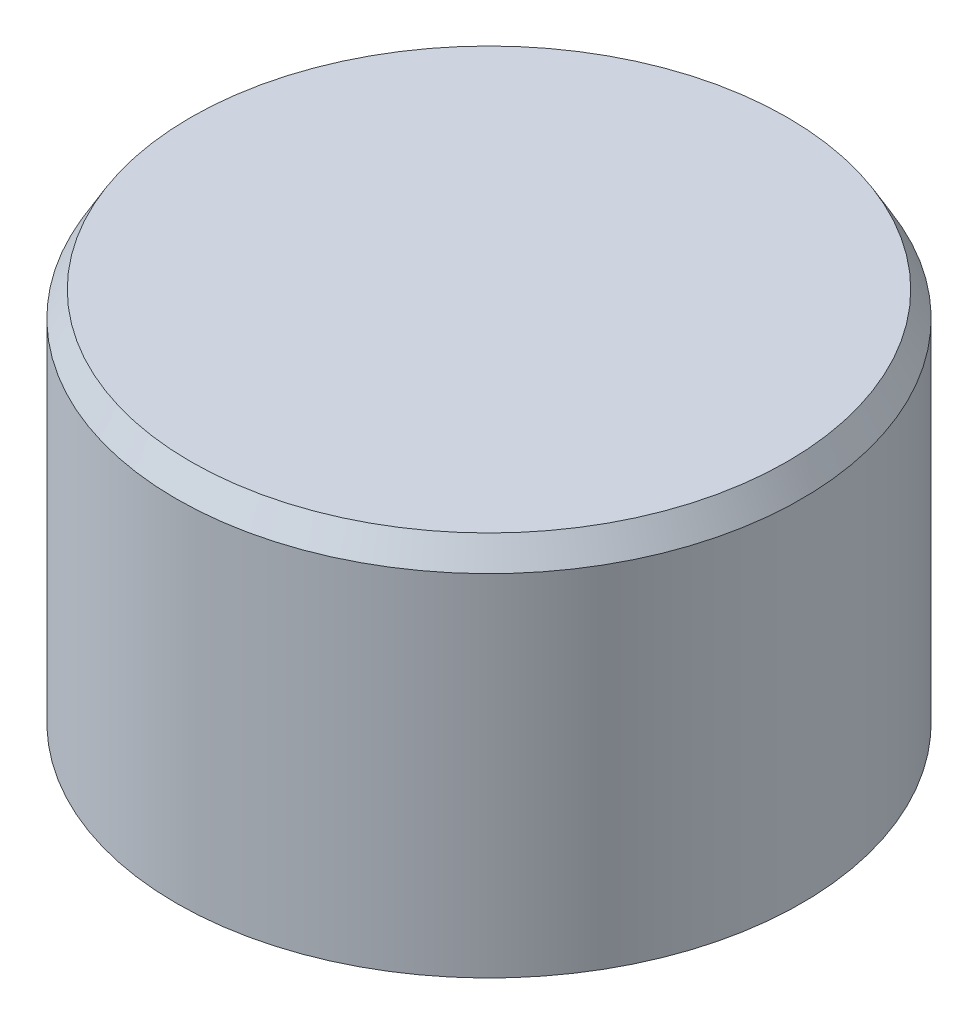
from build123d import *

# Parameters (mm, degrees)
SKETCH_199_R          = 12.5
EXTRUDE_246_DEPTH     = 15
SKETCH_289_R          = 10
CUT_EXTRUDE_344_DEPTH = 3
CHAMFER_1_SIZE        = 1
CHAMFER_1_SIZE2       = 0.577350269
SKETCH_1_R            = 1.5
CUT_EXTRUDE_1_DEPTH   = 8


with BuildPart() as part:
    # Sketch 199 → Extrude 246 (new body)
    with BuildSketch(Plane(origin=(0, 0, 0), x_dir=(1, 0, 0), z_dir=(0, 1, 0))):
        Circle(SKETCH_199_R)
    extrude(amount=EXTRUDE_246_DEPTH)

    # Sketch 289 → Cut-Extrude 344 (cut)
    with BuildSketch(Plane(origin=(0, 0, 0), x_dir=(1, 0, 0), z_dir=(0, 1, 0))):
        Circle(SKETCH_289_R)
    extrude(amount=CUT_EXTRUDE_344_DEPTH, mode=Mode.SUBTRACT)

    # Фаска1
    chamfer_1_edges = [part.edges().sort_by_distance(p)[0] for p in [
        (-12.5, 15, 0),
    ]]
    chamfer_1_side = [part.faces().sort_by_distance(p)[0] for p in [
        (-12.5, 7.5, 0),
    ]]
    chamfer(chamfer_1_edges, length=CHAMFER_1_SIZE, length2=CHAMFER_1_SIZE2, reference=chamfer_1_side[0])

    # Эскиз1 → Вырез-Вытянуть1 (cut)
    with BuildSketch(Plane(origin=(0, 0, 0), x_dir=(1, 0, 0), z_dir=(0, 1, 0))):
        Circle(SKETCH_1_R)
    extrude(amount=CUT_EXTRUDE_1_DEPTH, mode=Mode.SUBTRACT)


solid = part.part
